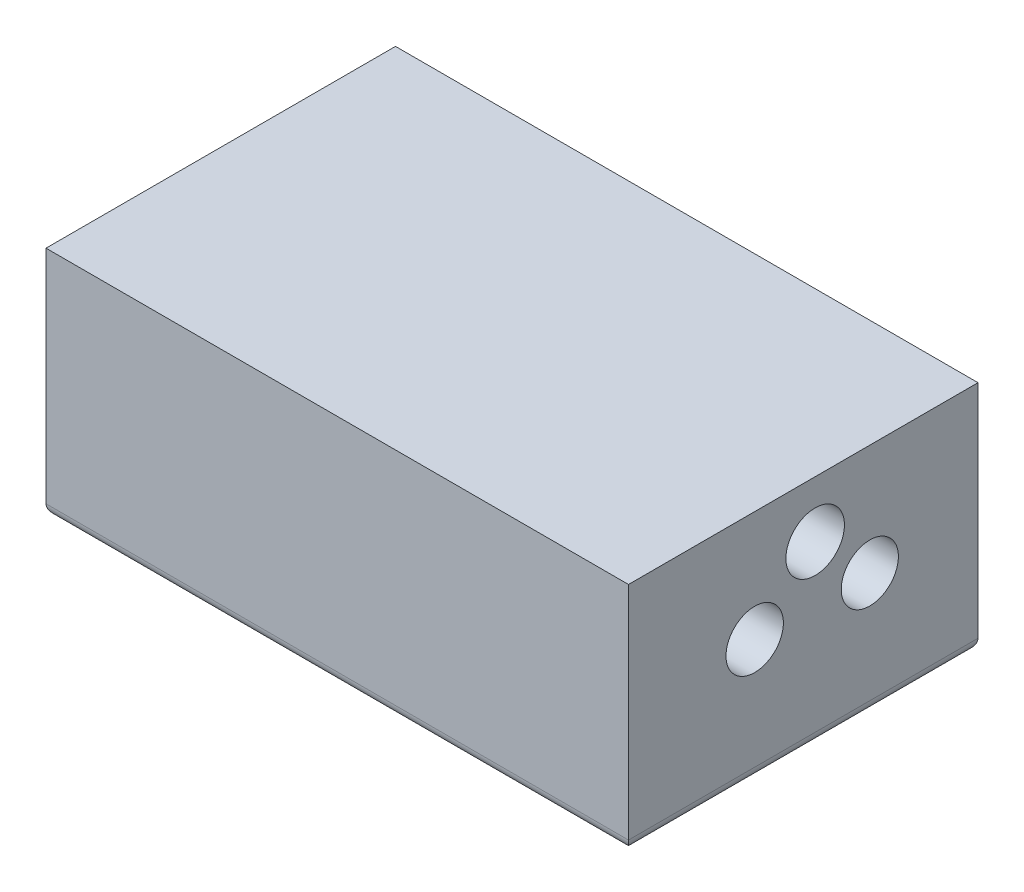
from build123d import *

# Parameters (mm, degrees)
SKETCH2_W           = 127
SKETCH2_H           = 76.2
BOSS_EXTRUDE1_DEPTH = 50.8
SKETCH17_R          = 6.233963983
SKETCH17_R_2        = 6.260224759
CUT_EXTRUDE4_DEPTH  = 15.24
SKETCH18_R          = 6.382369862
CUT_EXTRUDE5_DEPTH  = 10.16
SKETCH19_W          = 3.590234939
SKETCH19_H          = 76.2
BOSS_EXTRUDE2_DEPTH = 30.48
SKETCH20_W          = 6.335235137
SKETCH20_H          = 76.2
BOSS_EXTRUDE3_DEPTH = 25.4
SKETCH21_W          = 76.2
SKETCH21_H          = 5.689014135
BOSS_EXTRUDE4_DEPTH = 25.4
FILLET1_R           = 2.54


with BuildPart() as part:
    # Sketch2 → Boss-Extrude1 (new body)
    with BuildSketch(Plane(origin=(0, 0, 0), x_dir=(1, 0, 0), z_dir=(0, 1, 0))):
        Rectangle(SKETCH2_W, SKETCH2_H)
    extrude(amount=BOSS_EXTRUDE1_DEPTH)

    # Sketch17 → Cut-Extrude4 (cut)
    with BuildSketch(Plane(origin=(63.5, 0, 0), x_dir=(0, 0, -1), z_dir=(1, 0, 0))):
        with Locations((14.512421681, 26.67)):
            Circle(SKETCH17_R)
        with Locations((-10.586901423, 26.67)):
            Circle(SKETCH17_R_2)
    extrude(amount=-CUT_EXTRUDE4_DEPTH, mode=Mode.SUBTRACT)

    # Sketch18 → Cut-Extrude5 (cut)
    with BuildSketch(Plane(origin=(63.5, 0, 0), x_dir=(0, 0, -1), z_dir=(1, 0, 0))):
        with Locations((2.598113401, 38.528663857)):
            Circle(SKETCH18_R)
    extrude(amount=-CUT_EXTRUDE5_DEPTH, mode=Mode.SUBTRACT)

    # Sketch19 → Boss-Extrude2 (add)
    with BuildSketch(Plane.XZ):
        with Locations((-30.005608019, 0)):
            Rectangle(SKETCH19_W, SKETCH19_H)
    extrude(amount=-BOSS_EXTRUDE2_DEPTH)

    # Sketch20 → Boss-Extrude3 (add)
    with BuildSketch(Plane.XZ):
        with Locations((-41.686612765, 0)):
            Rectangle(SKETCH20_W, SKETCH20_H)
    extrude(amount=-BOSS_EXTRUDE3_DEPTH)

    # Sketch21 → Boss-Extrude4 (add)
    with BuildSketch(Plane.ZY.offset(63.5)):
        with Locations((0, 28.244507068)):
            Rectangle(SKETCH21_W, SKETCH21_H)
    extrude(amount=-BOSS_EXTRUDE4_DEPTH)

    # Fillet1
    fillet1_edges = [part.edges().sort_by_distance(p)[0] for p in [
        (0, 0, -38.1),
        (-63.5, 0, 0),
        (0, 0, 38.1),
        (63.5, 0, 0),
    ]]
    fillet(fillet1_edges, radius=FILLET1_R)


solid = part.part
